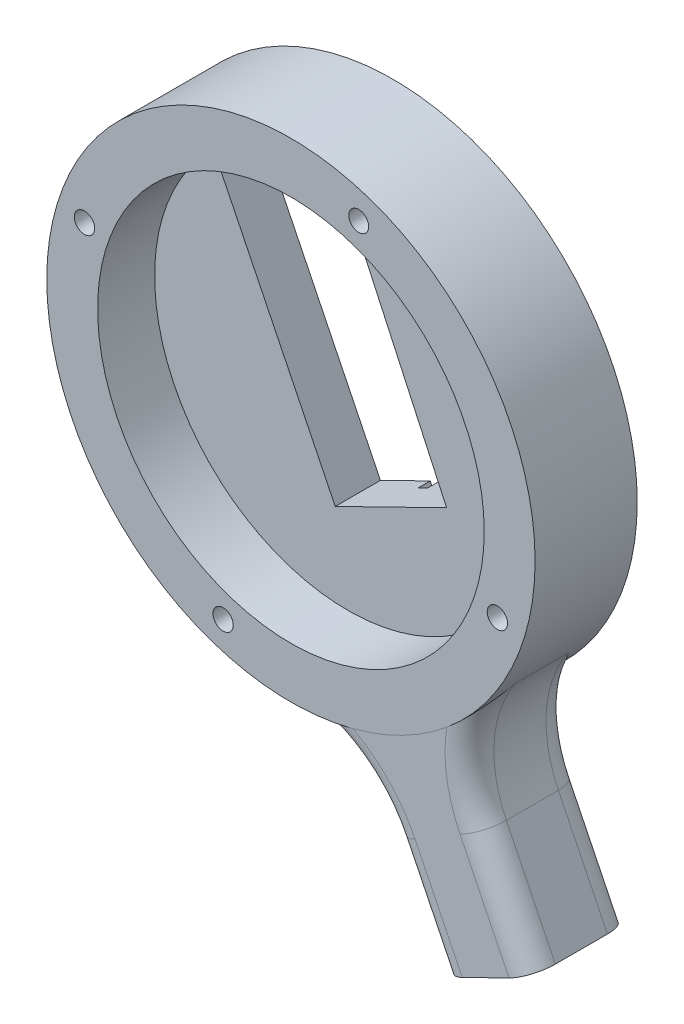
from build123d import *

# Parameters (mm, degrees)
SKETCH1_R                = 60
BOSS_EXTRUDE1_DEPTH      = 25.1
SKETCH3_R                = 47.5
CUT_EXTRUDE2_DEPTH       = 14
CUT_EXTRUDE5_DEPTH       = 89.487343728
CUT_EXTRUDE5_DEPTH_BACK  = 89.487343728
SKETCH2_R                = 2.494998654
SKETCH2_R_2              = 2.5
SKETCH2_R_3              = 2.444443829
SKETCH6_R                = 3
CUT_EXTRUDE6_DEPTH       = 6
CUT_EXTRUDE7_DEPTH       = 87
CUT_EXTRUDE7_DEPTH_BACK  = 87
BOSS_EXTRUDE2_DEPTH      = 30
BOSS_EXTRUDE2_DEPTH_BACK = 23
SKETCH8_W                = 24.8
SKETCH8_H                = 24.8
FILLET1_R                = 30
SKETCH9_R                = 6.1
CUT_EXTRUDE8_DEPTH       = 40
FILLET2_R                = 6
CUT_EXTRUDE9_DEPTH       = 3


with BuildPart() as part:
    # Sketch1 → Boss-Extrude1 (new body)
    with BuildSketch(Plane.XY):
        Circle(SKETCH1_R)
    extrude(amount=BOSS_EXTRUDE1_DEPTH)

    # Sketch3 → Cut-Extrude2 (cut)
    with BuildSketch(Plane.XY.offset(25.1)):
        Circle(SKETCH3_R)
    extrude(amount=-CUT_EXTRUDE2_DEPTH, mode=Mode.SUBTRACT)

    # Sketch2 → Cut-Extrude5 (cut, two sides: drawn at the far end of the back side and taken through both)
    with BuildSketch(Plane.XY.offset(25.1).offset(-CUT_EXTRUDE5_DEPTH_BACK)):
        with Locations((-16.664697145, -50.733104448)):
            Circle(SKETCH2_R)
        with Locations((-50.733105114, 16.664696544)):
            Circle(SKETCH2_R_2)
        with Locations((16.664695878, 50.733104512)):
            Circle(SKETCH2_R_3)
        with Locations((50.733103846, -16.66469648)):
            Circle(SKETCH2_R_2)
    extrude(amount=CUT_EXTRUDE5_DEPTH + CUT_EXTRUDE5_DEPTH_BACK, mode=Mode.SUBTRACT)

    # Sketch6 → Cut-Extrude6 (cut)
    with BuildSketch(Plane(origin=(0, 0, 0), x_dir=(-1, 0, 0), z_dir=(0, 0, -1))):
        with Locations((11.973502988, 47.212610548)):
            Circle(SKETCH6_R)
        with Locations((27.381285989, 40.029281029)):
            Circle(SKETCH6_R)
        with Locations((-19.717656658, -20.762902692)):
            Circle(SKETCH6_R)
        with Locations((-4.309873657, -27.946232212)):
            Circle(SKETCH6_R)
    extrude(amount=-CUT_EXTRUDE6_DEPTH, mode=Mode.SUBTRACT)

    # Sketch7 → Cut-Extrude7 (cut, two sides: drawn at the far end of the back side and taken through both)
    with BuildSketch(Plane.XY.offset(11.1).offset(-CUT_EXTRUDE7_DEPTH_BACK)):
        Polygon((-32.400942803, 32.871850778), (-3.10901045, -26.912408633), (24.254242539, -13.505492441), (-3.650778768, 46.958298756), align=None)
    extrude(amount=CUT_EXTRUDE7_DEPTH + CUT_EXTRUDE7_DEPTH_BACK, mode=Mode.SUBTRACT)

    # Sketch8 → Boss-Extrude2 (add, two sides: drawn at the far end of the back side and taken through both)
    with BuildSketch(Plane(origin=(33.53796733, -68.45033352, 0), x_dir=(-0.8980042769467113, -0.4399867254650012, 0), z_dir=(0.4399867254650012, -0.8980042769467113, 0)).offset(-BOSS_EXTRUDE2_DEPTH_BACK)):
        with Locations((-0.981202476, -12.478185074)):
            Rectangle(SKETCH8_W, SKETCH8_H)
    extrude(amount=BOSS_EXTRUDE2_DEPTH + BOSS_EXTRUDE2_DEPTH_BACK)

    # Fillet1
    fillet1_edges = [part.edges().sort_by_distance(p)[0] for p in [
        (15.662587056, -57.91962851, 12.478185074),
        (37.75068654, -46.635669457, 12.478185074),
    ]]
    fillet(fillet1_edges, radius=FILLET1_R)

    # Sketch9 → Cut-Extrude8 (cut)
    with BuildSketch(Plane(origin=(46.737569094, -95.390461829, 0), x_dir=(0.8980042769467111, 0.43998672546500134, 0), z_dir=(0.43998672546500134, -0.8980042769467111, 0))):
        with Locations((0.981202476, 12.478185074)):
            Circle(SKETCH9_R)
    extrude(amount=-CUT_EXTRUDE8_DEPTH, mode=Mode.SUBTRACT)

    # Fillet2
    fillet2_edges = [part.edges().sort_by_distance(p)[0] for p in [
        (30.692776664, -88.595950704, 24.878185074),
        (14.123899269, -64.702576813, 24.878185074),
    ]]
    fillet(fillet2_edges, radius=FILLET2_R)
    fillet2_2_edges = [part.edges().sort_by_distance(p)[0] for p in [
        (52.732682767, -77.213629905, 24.878185074),
        (43.74355485, -49.376990438, 24.878185074),
    ]]
    fillet(fillet2_2_edges, radius=FILLET2_R)
    fillet2_3_edges = [part.edges().sort_by_distance(p)[0] for p in [
        (14.123899269, -64.702576813, 0.078185074),
        (30.692776664, -88.595950704, 0.078185074),
    ]]
    fillet(fillet2_3_edges, radius=FILLET2_R)
    fillet2_4_edges = [part.edges().sort_by_distance(p)[0] for p in [
        (52.732682767, -77.213629905, 0.078185074),
        (43.74355485, -49.376990438, 0.078185074),
    ]]
    fillet(fillet2_4_edges, radius=FILLET2_R)

    # Sketch12 → Cut-Extrude9 (cut)
    with BuildSketch(Plane(origin=(0, 0, 0), x_dir=(-1, 0, 0), z_dir=(0, 0, -1))):
        Polygon((16.569778792, 40.628497592), (19.583965842, 46.780394242), (22.182787305, 45.507074086), (19.168600256, 39.355177436), align=None)
        Polygon((-11.458078278, -19.775108918), (-14.390783054, -26.33846158), (-12.052056845, -27.383475291), (-9.156328603, -20.902875599), align=None)
    extrude(amount=-CUT_EXTRUDE9_DEPTH, mode=Mode.SUBTRACT)


solid = part.part
